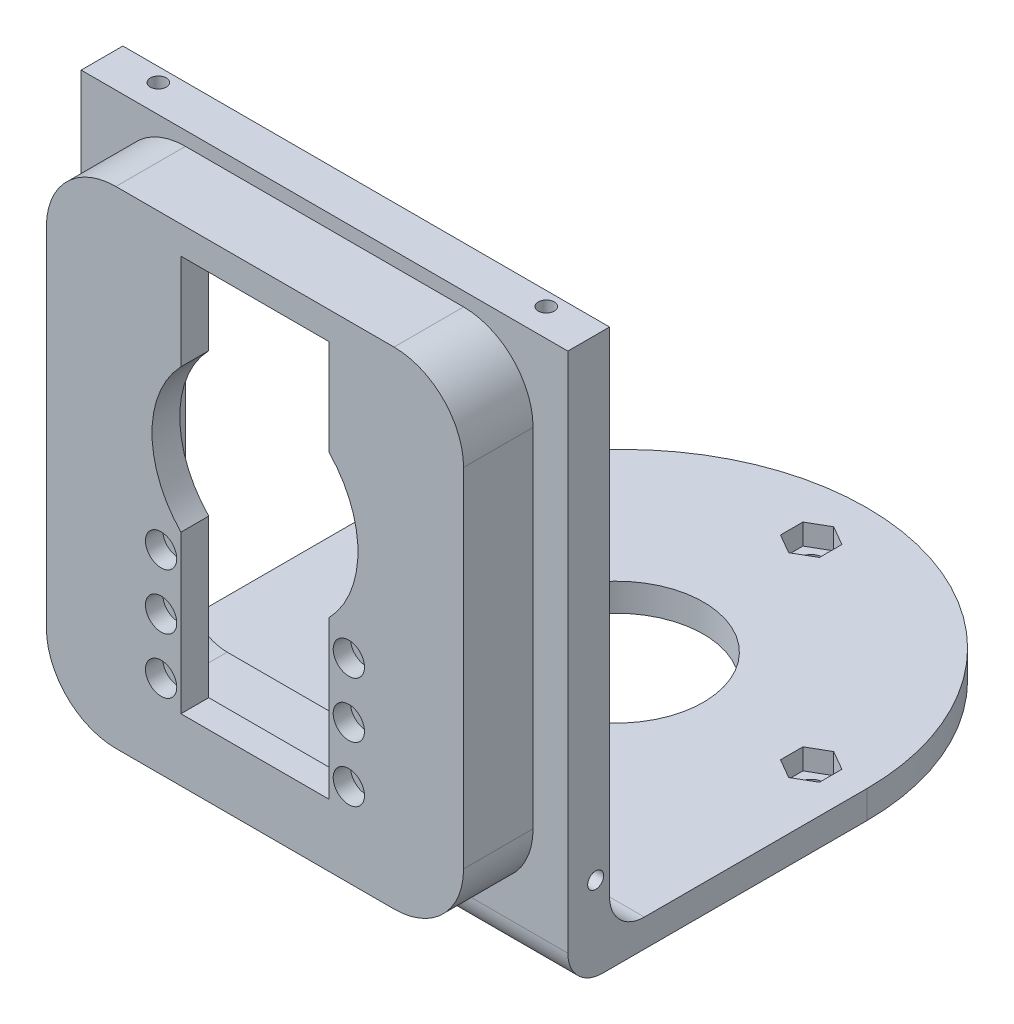
from build123d import *

# Parameters (mm, degrees)
BOSS_EXTRUDE1_DEPTH = 10
SKETCH10_W          = 70
SKETCH10_H          = 80
BOSS_EXTRUDE6_DEPTH = 78
CUT_EXTRUDE7_DEPTH  = 46
SKETCH15_R          = 1.25
BOSS_EXTRUDE7_DEPTH = 4
SKETCH17_R          = 2.25
CUT_EXTRUDE9_DEPTH  = 2.5
SKETCH19_W          = 72
SKETCH19_H          = 76
CUT_EXTRUDE11_DEPTH = 70
SKETCH20_R          = 1.65
CUT_EXTRUDE12_DEPTH = 10
SKETCH21_R          = 12.5
CUT_EXTRUDE13_DEPTH = 10
CUT_EXTRUDE14_DEPTH = 3
FILLET3_R           = 5
SKETCH23_W          = 2
SKETCH23_H          = 4.2
CUT_EXTRUDE15_DEPTH = 4
SKETCH24_R          = 1.15
CUT_EXTRUDE16_DEPTH = 118
SKETCH27_W          = 4.2
SKETCH27_H          = 2
CUT_EXTRUDE17_DEPTH = 4
SKETCH28_R          = 1.15
CUT_EXTRUDE18_DEPTH = 121.187353744
FILLET4_R           = 35
SKETCH29_R          = 14.814456412
CUT_EXTRUDE19_DEPTH = 4


with BuildPart() as part:
    # Sketch1 → Boss-Extrude1 (new body)
    with BuildSketch(Plane.XY):
        with BuildLine():
            Line((-20, -35), (20, -35))
            ThreePointArc((20, -35), (27.071067812, -32.071067812), (30, -25))
            Line((30, -25), (30, 25))
            ThreePointArc((30, 25), (27.071067812, 32.071067812), (20, 35))
            Line((20, 35), (-20, 35))
            ThreePointArc((-20, 35), (-27.071067812, 32.071067812), (-30, 25))
            Line((-30, 25), (-30, -25))
            ThreePointArc((-30, -25), (-27.071067812, -32.071067812), (-20, -35))
        make_face()
    extrude(amount=-BOSS_EXTRUDE1_DEPTH)

    # Sketch10 → Boss-Extrude6 (add)
    with BuildSketch(Plane(origin=(0, 0, -10), x_dir=(-1, 0, 0), z_dir=(0, 0, -1))):
        with Locations((0, -3)):
            Rectangle(SKETCH10_W, SKETCH10_H)
    extrude(amount=BOSS_EXTRUDE6_DEPTH)

    # Sketch14 → Cut-Extrude7 (cut)
    with BuildSketch(Plane.XY):
        with BuildLine():
            Line((20, 31), (-20, 31))
            ThreePointArc((-20, 31), (-24.242640687, 29.242640687), (-26, 25))
            Line((-26, 25), (-26, -25))
            ThreePointArc((-26, -25), (-24.242640687, -29.242640687), (-20, -31))
            Line((-20, -31), (20, -31))
            ThreePointArc((20, -31), (24.242640687, -29.242640687), (26, -25))
            Line((26, -25), (26, 25))
            ThreePointArc((26, 25), (24.242640687, 29.242640687), (20, 31))
        make_face()
    extrude(amount=-CUT_EXTRUDE7_DEPTH, mode=Mode.SUBTRACT)

    # Sketch15 → Boss-Extrude7 (add)
    with BuildSketch(Plane.XY):
        with BuildLine():
            Line((-20, 31), (-10.65, 31))
            Line((-10.65, 31), (-10.65, -26))
            Line((-10.65, -26), (10.65, -26))
            Line((10.65, -26), (10.65, 31))
            Line((10.65, 31), (20, 31))
            ThreePointArc((20, 31), (24.242640687, 29.242640687), (26, 25))
            Line((26, 25), (26, -25))
            ThreePointArc((26, -25), (24.242640687, -29.242640687), (20, -31))
            Line((20, -31), (-20, -31))
            ThreePointArc((-20, -31), (-24.242640687, -29.242640687), (-26, -25))
            Line((-26, -25), (-26, 25))
            ThreePointArc((-26, 25), (-24.242640687, 29.242640687), (-20, 31))
        make_face()
        with Locations((13.5, -7)):
            Circle(SKETCH15_R, mode=Mode.SUBTRACT)
        with Locations((13.5, -15)):
            Circle(SKETCH15_R, mode=Mode.SUBTRACT)
        with Locations((13.5, -23)):
            Circle(SKETCH15_R, mode=Mode.SUBTRACT)
        with Locations(Location((-13.5, -7, 0), (0, 0, 180))):
            Circle(SKETCH15_R, mode=Mode.SUBTRACT)
        with Locations(Location((-13.5, -15, 0), (0, 0, 180))):
            Circle(SKETCH15_R, mode=Mode.SUBTRACT)
        with Locations(Location((-13.5, -23, 0), (0, 0, 180))):
            Circle(SKETCH15_R, mode=Mode.SUBTRACT)
    extrude(amount=-BOSS_EXTRUDE7_DEPTH)

    # Sketch17 → Cut-Extrude9 (cut)
    with BuildSketch(Plane.XY):
        with Locations((-13.5, -7)):
            Circle(SKETCH17_R)
        with Locations((-13.5, -15)):
            Circle(SKETCH17_R)
        with Locations((-13.5, -23)):
            Circle(SKETCH17_R)
        with Locations((13.5, -7)):
            Circle(SKETCH17_R)
        with Locations((13.5, -15)):
            Circle(SKETCH17_R)
        with Locations((13.5, -23)):
            Circle(SKETCH17_R)
    extrude(amount=-CUT_EXTRUDE9_DEPTH, mode=Mode.SUBTRACT)

    # Sketch19 → Cut-Extrude11 (cut)
    with BuildSketch(Plane(origin=(35, 0, 0), x_dir=(0, 0, -1), z_dir=(1, 0, 0))):
        with Locations((52, -1)):
            Rectangle(SKETCH19_W, SKETCH19_H)
    extrude(amount=-CUT_EXTRUDE11_DEPTH, mode=Mode.SUBTRACT)

    # Sketch20 → Cut-Extrude12 (cut)
    with BuildSketch(Plane.XZ.offset(43)):
        with Locations(Location((28, -52, 0), (0, 0, 270))):
            Circle(SKETCH20_R)
        with Locations(Location((0, -80, 0), (0, 0, 270))):
            Circle(SKETCH20_R)
        with Locations(Location((-28, -52, 0), (0, 0, 270))):
            Circle(SKETCH20_R)
    extrude(amount=-CUT_EXTRUDE12_DEPTH, mode=Mode.SUBTRACT)

    # Sketch21 → Cut-Extrude13 (cut)
    with BuildSketch(Plane(origin=(0, -39, 0), x_dir=(1, 0, 0), z_dir=(0, 1, 0))):
        with Locations(Location((0, 52, 0), (0, 0, 270))):
            Circle(SKETCH21_R)
    extrude(amount=-CUT_EXTRUDE13_DEPTH, mode=Mode.SUBTRACT)

    # Sketch22 → Cut-Extrude14 (cut)
    with BuildSketch(Plane(origin=(0, -39, 0), x_dir=(1, 0, 0), z_dir=(0, 1, 0))):
        Polygon((0, 83.233161507), (-2.8, 81.616580754), (-2.8, 78.383419246), (0, 76.766838493), (2.8, 78.383419246), (2.8, 81.616580754), align=None)
        Polygon((-30.8, 50.383419246), (-28, 48.766838493), (-25.2, 50.383419246), (-25.2, 53.616580754), (-28, 55.233161507), (-30.8, 53.616580754), align=None)
        Polygon((28, 55.233161507), (25.2, 53.616580754), (25.2, 50.383419246), (28, 48.766838493), (30.8, 50.383419246), (30.8, 53.616580754), align=None)
    extrude(amount=-CUT_EXTRUDE14_DEPTH, mode=Mode.SUBTRACT)

    # Fillet3
    fillet3_edges = [part.edges().sort_by_distance(p)[0] for p in [
        (0, -39, -16),
        (0, -43, -10),
    ]]
    fillet(fillet3_edges, radius=FILLET3_R)

    # Sketch23 → Cut-Extrude15 (cut)
    with BuildSketch(Plane(origin=(0, 0, -16), x_dir=(-1, 0, 0), z_dir=(0, 0, -1))):
        with Locations((-30, -30.9)):
            Rectangle(SKETCH23_W, SKETCH23_H)
    cut_extrude15 = extrude(amount=-CUT_EXTRUDE15_DEPTH, mode=Mode.SUBTRACT)

    # Sketch24 → Cut-Extrude16 (cut, through all)
    with BuildSketch(Plane(origin=(29, 0, 0), x_dir=(0, 0, -1), z_dir=(1, 0, 0))):
        with Locations(Location((14, -30.9, 0), (0, 0, 90))):
            Circle(SKETCH24_R)
    cut_extrude16 = extrude(amount=CUT_EXTRUDE16_DEPTH, mode=Mode.SUBTRACT)

    # Mirror1: Cut-Extrude15, Cut-Extrude16 across plane
    add(cut_extrude15.mirror(Plane(origin=(0, 0, 0), x_dir=(0, 0, 1), z_dir=(1, 0, 0))), mode=Mode.SUBTRACT)
    add(cut_extrude16.mirror(Plane(origin=(0, 0, 0), x_dir=(0, 0, 1), z_dir=(1, 0, 0))), mode=Mode.SUBTRACT)

    # Sketch27 → Cut-Extrude17 (cut)
    with BuildSketch(Plane(origin=(0, 0, -16), x_dir=(-1, 0, 0), z_dir=(0, 0, -1))):
        with Locations((27.9, 32)):
            Rectangle(SKETCH27_W, SKETCH27_H)
        with Locations((-27.9, 32)):
            Rectangle(SKETCH27_W, SKETCH27_H)
    extrude(amount=-CUT_EXTRUDE17_DEPTH, mode=Mode.SUBTRACT)

    # Sketch28 → Cut-Extrude18 (cut, through all)
    with BuildSketch(Plane(origin=(0, 31, 0), x_dir=(1, 0, 0), z_dir=(0, 1, 0))):
        with Locations(Location((-27.9, 14, 0), (0, 0, 180))):
            Circle(SKETCH28_R)
    cut_extrude18 = extrude(amount=CUT_EXTRUDE18_DEPTH, mode=Mode.SUBTRACT)

    # Mirror2: Cut-Extrude18 across plane
    add(cut_extrude18.mirror(Plane(origin=(0, 0, 0), x_dir=(0, 0, 1), z_dir=(1, 0, 0))), mode=Mode.SUBTRACT)

    # Fillet4
    fillet4_edges = [part.edges().sort_by_distance(p)[0] for p in [
        (35, -41, -88),
        (-35, -41, -88),
    ]]
    fillet(fillet4_edges, radius=FILLET4_R - 0.0001)  # a hair under: the kernel refuses the full size

    # Sketch29 → Cut-Extrude19 (cut)
    with BuildSketch(Plane.XY):
        with Locations((0, 6.918633542)):
            Circle(SKETCH29_R)
    extrude(amount=-CUT_EXTRUDE19_DEPTH, mode=Mode.SUBTRACT)


solid = part.part
